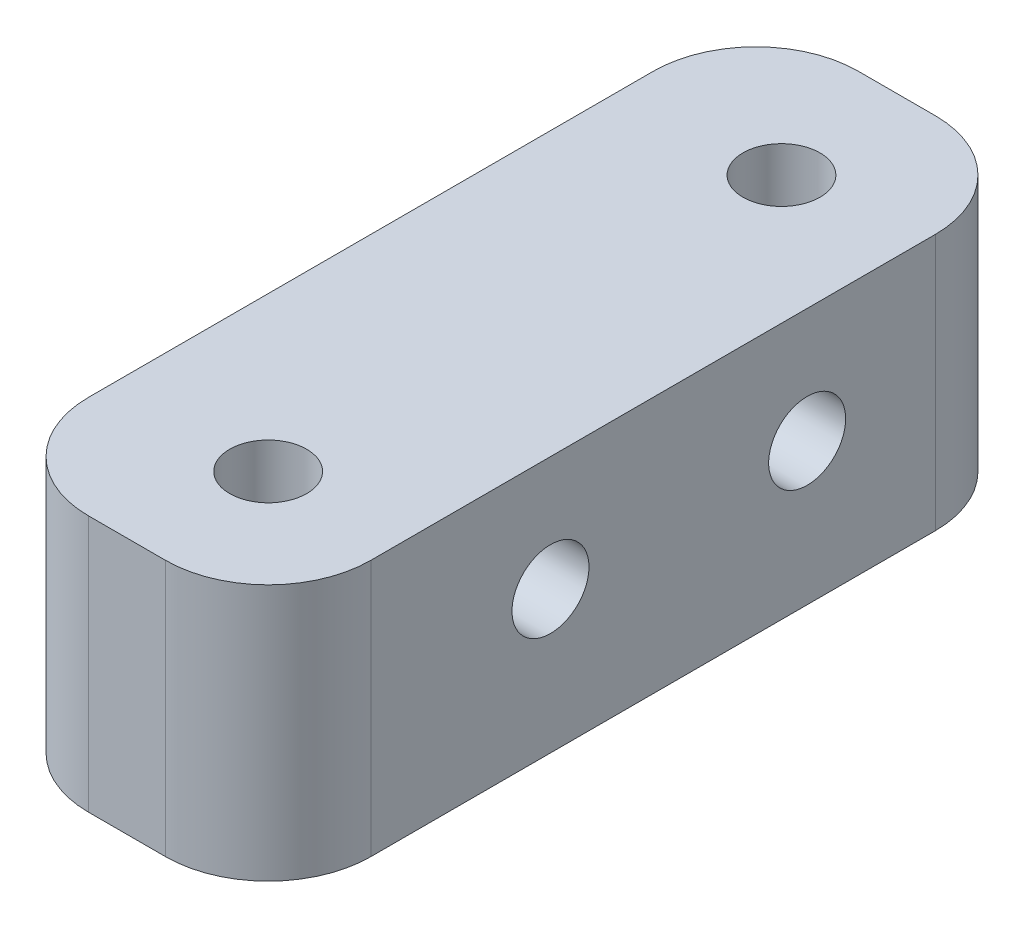
from build123d import *

# Parameters (mm, degrees)
SKETCH1_W           = 11
SKETCH1_H           = 30
SKETCH1_R           = 1.5
BOSS_EXTRUDE1_DEPTH = 10
SKETCH2_R           = 1.5
CUT_EXTRUDE1_DEPTH  = 34.481338086
FILLET1_R           = 4


with BuildPart() as part:
    # Sketch1 → Boss-Extrude1 (new body)
    with BuildSketch(Plane(origin=(0, 0, 0), x_dir=(1, 0, 0), z_dir=(0, 1, 0))):
        with Locations((5.5, 15)):
            Rectangle(SKETCH1_W, SKETCH1_H)
        with Locations((6, 25)):
            Circle(SKETCH1_R, mode=Mode.SUBTRACT)
        with Locations((6, 5)):
            Circle(SKETCH1_R, mode=Mode.SUBTRACT)
    extrude(amount=BOSS_EXTRUDE1_DEPTH)

    # Sketch2 → Cut-Extrude1 (cut, through all)
    with BuildSketch(Plane(origin=(11, 0, 0), x_dir=(0, 0, -1), z_dir=(1, 0, 0))):
        with Locations((11, 5.530453401)):
            Circle(SKETCH2_R)
        with Locations((21, 5.530453401)):
            Circle(SKETCH2_R)
    extrude(amount=-CUT_EXTRUDE1_DEPTH, mode=Mode.SUBTRACT)

    # Fillet1
    fillet1_edges = [part.edges().sort_by_distance(p)[0] for p in [
        (0, 5, -30),
        (11, 5, -30),
        (0, 5, 0),
        (11, 5, 0),
    ]]
    fillet(fillet1_edges, radius=FILLET1_R)


solid = part.part
